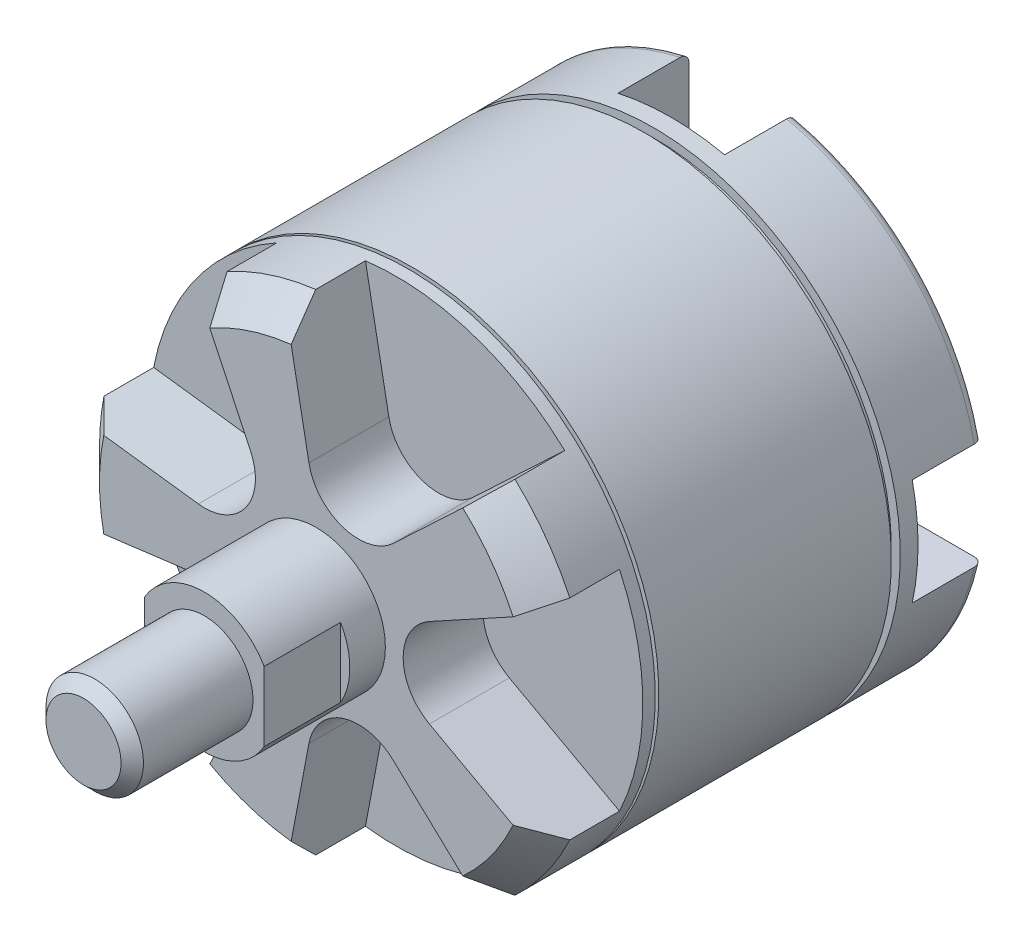
from build123d import *

# Parameters (mm, degrees)
SKETCH1_R           = 13.9
BOSS_EXTRUDE1_DEPTH = 24
FILLET1_R           = 0.5
CUT_EXTRUDE1_DEPTH  = 4
CUT_EXTRUDE2_DEPTH  = 4
SKETCH4_R           = 4
BOSS_EXTRUDE2_DEPTH = 0.1
SKETCH5_R           = 3
BOSS_EXTRUDE3_DEPTH = 0.5
SKETCH6_R           = 1.5
BOSS_EXTRUDE4_DEPTH = 0.6
SKETCH7_R           = 1.5
CUT_EXTRUDE3_DEPTH  = 4
CHAMFER1_SIZE       = 1.7
CUT_EXTRUDE4_START  = -4.5
CUT_EXTRUDE4_DEPTH  = 4.5
SKETCH9_R           = 3.9
BOSS_EXTRUDE5_DEPTH = 6.3
CUT_EXTRUDE5_START  = -4.3
CUT_EXTRUDE5_DEPTH  = 4.3
SKETCH10_R          = 2.9
BOSS_EXTRUDE6_DEPTH = 6.8
SKETCH16_W          = 0.5
SKETCH16_H          = 0.5
SKETCH16_H_2        = 0.2


# Read off the part's stored shape, not the designer's step: #12-24 Machine Threads Stud1
with BuildPart() as part:
    # Sketch1 → Boss-Extrude1 (new body)
    with BuildSketch(Plane.XY):
        Circle(SKETCH1_R)
    extrude(amount=BOSS_EXTRUDE1_DEPTH)

    # Fillet1
    fillet1_edges = [part.edges().sort_by_distance(p)[0] for p in [
        (-13.9, 0, 0),
    ]]
    fillet(fillet1_edges, radius=FILLET1_R)

    # Sketch2 → Cut-Extrude1 (cut)
    with BuildSketch(Plane(origin=(0, 0, 0), x_dir=(-1, 0, 0), z_dir=(0, 0, -1))):
        with BuildLine():
            Line((-13.572398462, 3), (-9.572398462, 3))
            ThreePointArc((-9.572398462, 3), (-6.572398365, 0), (-9.572398462, -3))
            Line((-9.572398462, -3), (-13.572398462, -3))
            ThreePointArc((-13.572398462, -3), (-13.9, 0), (-13.572398462, 3))
        make_face()
        with BuildLine():
            Line((3, 13.572398462), (3, 9.572398462))
            ThreePointArc((3, 9.572398462), (0, 6.572398365), (-3, 9.572398462))
            Line((-3, 9.572398462), (-3, 13.572398462))
            ThreePointArc((-3, 13.572398462), (0, 13.9), (3, 13.572398462))
        make_face()
        with BuildLine():
            Line((13.572398462, -3), (9.572398462, -3))
            ThreePointArc((9.572398462, -3), (6.572398365, 0), (9.572398462, 3))
            Line((9.572398462, 3), (13.572398462, 3))
            ThreePointArc((13.572398462, 3), (13.9, 0), (13.572398462, -3))
        make_face()
    extrude(amount=-CUT_EXTRUDE1_DEPTH, mode=Mode.SUBTRACT)

    # Sketch3 → Cut-Extrude2 (cut)
    with BuildSketch(Plane(origin=(0, 0, 0), x_dir=(-1, 0, 0), z_dir=(0, 0, -1))):
        with BuildLine():
            Line((-5, -12.969579793), (-2.5, -8.384373134))
            ThreePointArc((-2.5, -8.384373134), (0, -6.9), (2.5, -8.384373134))
            Line((2.5, -8.384373134), (5, -12.969579793))
            ThreePointArc((5, -12.969579793), (0, -13.9), (-5, -12.969579793))
        make_face()
    extrude(amount=-CUT_EXTRUDE2_DEPTH, mode=Mode.SUBTRACT)

    # Sketch4 → Boss-Extrude2 (add)
    with BuildSketch(Plane(origin=(0, 0, 0), x_dir=(-1, 0, 0), z_dir=(0, 0, -1))):
        with Locations(Location((0, 0, 0), (0, 0, 180))):
            Circle(SKETCH4_R)
    extrude(amount=BOSS_EXTRUDE2_DEPTH)

    # Sketch5 → Boss-Extrude3 (add)
    with BuildSketch(Plane(origin=(0, 0, -0.1), x_dir=(-1, 0, 0), z_dir=(0, 0, -1))):
        Circle(SKETCH5_R)
    extrude(amount=BOSS_EXTRUDE3_DEPTH)

    # Sketch6 → Boss-Extrude4 (add)
    with BuildSketch(Plane(origin=(0, 0, -0.6), x_dir=(-1, 0, 0), z_dir=(0, 0, -1))):
        Circle(SKETCH6_R)
    extrude(amount=BOSS_EXTRUDE4_DEPTH)

    # Sketch7 → Cut-Extrude3 (cut)
    with BuildSketch(Plane(origin=(0, 0, 0), x_dir=(-1, 0, 0), z_dir=(0, 0, -1))):
        with Locations((-5.656854249, 5.656854249)):
            Circle(SKETCH7_R)
        with Locations((6.717514421, 6.717514421)):
            Circle(SKETCH7_R)
        with Locations((5.656854249, -5.656854249)):
            Circle(SKETCH7_R)
        with Locations((-6.717514421, -6.717514421)):
            Circle(SKETCH7_R)
    extrude(amount=-CUT_EXTRUDE3_DEPTH, mode=Mode.SUBTRACT)

    # Chamfer1
    chamfer1_edges = [part.edges().sort_by_distance(p)[0] for p in [
        (-13.9, 0, 24),
    ]]
    chamfer(chamfer1_edges, length=CHAMFER1_SIZE)

    # Sketch8 → Cut-Extrude4 (cut)
    with BuildSketch(Plane.XY.offset(24).offset(CUT_EXTRUDE4_START)):
        with BuildLine():
            Line((12.585706178, 5.9), (6.380828907, 2.5))
            ThreePointArc((6.380828907, 2.5), (4.9, 0), (6.380828907, -2.5))
            Line((6.380828907, -2.5), (12.585706178, -5.9))
            ThreePointArc((12.585706178, -5.9), (13.9, 0), (12.585706178, 5.9))
        make_face()
        with BuildLine():
            Line((9.500430541, -10.146517606), (4.349425861, -5.295986426))
            ThreePointArc((4.349425861, -5.295986426), (1.514183272, -4.66017693), (-0.40585672, -6.841071398))
            Line((-0.40585672, -6.841071398), (-1.722036351, -13.79291814))
            ThreePointArc((-1.722036351, -13.79291814), (4.295336222, -13.219685577), (9.500430541, -10.146517606))
        make_face()
        with BuildLine():
            Line((-6.714117196, -12.170892748), (-3.692735894, -5.773099615))
            ThreePointArc((-3.692735894, -5.773099615), (-3.964183272, -2.880147736), (-6.631662155, -1.728014643))
            Line((-6.631662155, -1.728014643), (-13.649983173, -2.624492214))
            ThreePointArc((-13.649983173, -2.624492214), (-11.245336222, -8.170215007), (-6.714117196, -12.170892748))
        make_face()
        with BuildLine():
            Line((-13.649983173, 2.624492214), (-6.631662155, 1.728014643))
            ThreePointArc((-6.631662155, 1.728014643), (-3.964183272, 2.880147736), (-3.692735894, 5.773099615))
            Line((-3.692735894, 5.773099615), (-6.714117196, 12.170892748))
            ThreePointArc((-6.714117196, 12.170892748), (-11.245336222, 8.170215007), (-13.649983173, 2.624492214))
        make_face()
        with BuildLine():
            Line((-1.722036351, 13.79291814), (-0.40585672, 6.841071398))
            ThreePointArc((-0.40585672, 6.841071398), (1.514183272, 4.66017693), (4.349425861, 5.295986426))
            Line((4.349425861, 5.295986426), (9.500430541, 10.146517606))
            ThreePointArc((9.500430541, 10.146517606), (4.295336222, 13.219685577), (-1.722036351, 13.79291814))
        make_face()
    extrude(amount=CUT_EXTRUDE4_DEPTH, mode=Mode.SUBTRACT)

    # Sketch9 → Boss-Extrude5 (add)
    with BuildSketch(Plane.XY.offset(24)):
        Circle(SKETCH9_R)
    extrude(amount=BOSS_EXTRUDE5_DEPTH)

    # Sketch11 → Cut-Extrude5 (cut)
    with BuildSketch(Plane.XY.offset(30.3).offset(CUT_EXTRUDE5_START)):
        with BuildLine():
            Line((3.375, 1.954322133), (3.375, -1.954322133))
            ThreePointArc((3.375, -1.954322133), (3.9, 0), (3.375, 1.954322133))
        make_face()
        with BuildLine():
            Line((-3.375, 1.954322133), (-3.375, -1.954322133))
            ThreePointArc((-3.375, -1.954322133), (-3.9, 0), (-3.375, 1.954322133))
        make_face()
    extrude(amount=CUT_EXTRUDE5_DEPTH, mode=Mode.SUBTRACT)

    # Sketch10 → Boss-Extrude6 (add)
    with BuildSketch(Plane.XY.offset(30.3)):
        Circle(SKETCH10_R)
    extrude(amount=BOSS_EXTRUDE6_DEPTH)

    # #12-24 Machine Threads Stud1 outline → #12-24 Machine Threads Stud1 (revolve, cut)
    with BuildSketch(Plane.XZ):
        Polygon((2.7432, 36.47008), (2.7432, 30.3), (2.9, 30.3), (2.9, 37.1), (2.11328, 37.1), align=None)
    revolve(axis=Axis((0, 0, 0), (0, 0, 1)), mode=Mode.SUBTRACT)

    # Sketch16 → Cut-Revolve1 (revolve, cut)
    with BuildSketch(Plane(origin=(0, 0, 0), x_dir=(1, 0, 0), z_dir=(0, 1, 0))):
        with Locations((-13.65, -5.25)):
            Rectangle(SKETCH16_W, SKETCH16_H)
        with Locations((13.65, -18.7)):
            Rectangle(SKETCH16_W, SKETCH16_H_2)
    revolve(axis=Axis((0, 0, -7.765685178), (0, 0, 1)), mode=Mode.SUBTRACT)


solid = part.part
